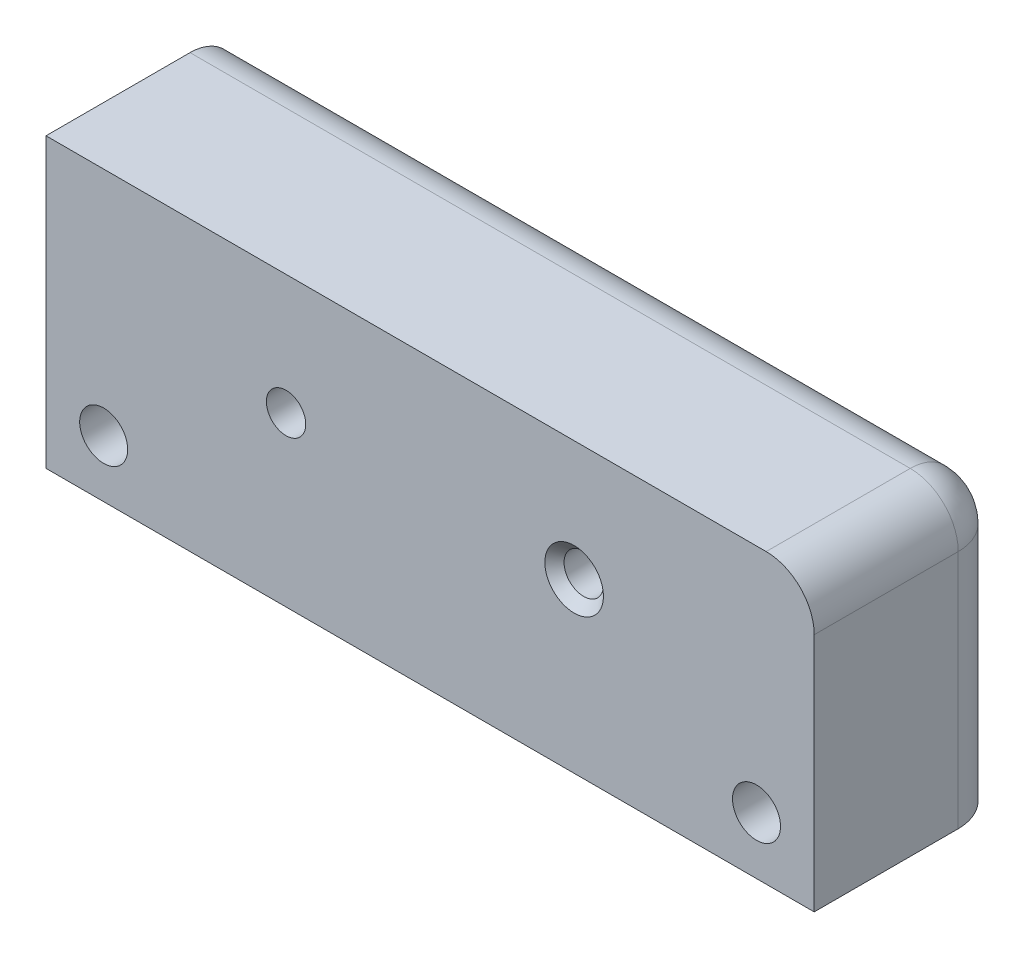
from build123d import *

# Parameters (mm, degrees)
SKETCH1_W                  = 80
SKETCH1_H                  = 40
CNFBOSS_EXTRUDE1_DEPTH     = 60
SKETCH2_R                  = 5
CNFCUT_DEPTH               = 108.703296143
F_8_2_8_2_DIAMETER_HOLE1_D = 8.2
CNFFILLET_R                = 10
CNFFILLET2_R               = 10
CNFCHAMFER_SIZE            = 2


with BuildPart() as part:
    # Sketch1 → cnfBoss-Extrude1 (new body)
    with BuildSketch(Plane(origin=(0, 0, 0), x_dir=(1, 0, 0), z_dir=(0, 1, 0))):
        with Locations((40, 20)):
            Rectangle(SKETCH1_W, SKETCH1_H)
    extrude(amount=CNFBOSS_EXTRUDE1_DEPTH)

    # Sketch2 → cnfCut (cut, through all)
    with BuildSketch(Plane.XY):
        with Locations((12.01333081, 11.907221875)):
            Circle(SKETCH2_R)
    extrude(amount=-CNFCUT_DEPTH, mode=Mode.SUBTRACT)

    # Ø8.2 (8.2) Diameter Hole1 (through all)
    with Locations(Plane.XY):
        with Locations((50, 35)):
            Hole(F_8_2_8_2_DIAMETER_HOLE1_D / 2)

    # cnfMirror: part across plane


with BuildPart() as part_1:
    add(part.part)
    add(part.part.mirror(Plane(origin=(80, 60, 0), x_dir=(0, 0, 1), z_dir=(-1, 0, 0))))

    # cnfFillet
    # the kernel refuses this fillet: 10 mm, written as the material it takes off along each edge
    with BuildSketch(Plane(origin=(160, -25, -40), x_dir=(-1, 0, 0), z_dir=(0, 1, 0))) as cnffillet_piece_1:
        with BuildLine():
            CenterArc((CNFFILLET_R, CNFFILLET_R), CNFFILLET_R, 180, 90)
            Line((0, CNFFILLET_R), (0, 0))
            Line((0, 0), (CNFFILLET_R, 0))
        make_face()
    extrude(amount=110, mode=Mode.SUBTRACT)

    # cnfFillet2
    cnffillet2_edges = [part_1.edges().sort_by_distance(p)[0] for p in [
        (75, 60, -40),
        (160, 60, -15),
        (157.071067812, 60, -37.071067812),
    ]]
    fillet(cnffillet2_edges, radius=CNFFILLET2_R)

    # cnfChamfer
    cnfchamfer_edges = [part_1.edges().sort_by_distance(p)[0] for p in [
        (105.9, 35, 0),
    ]]
    chamfer(cnfchamfer_edges, length=CNFCHAMFER_SIZE)


solid = part_1.part
